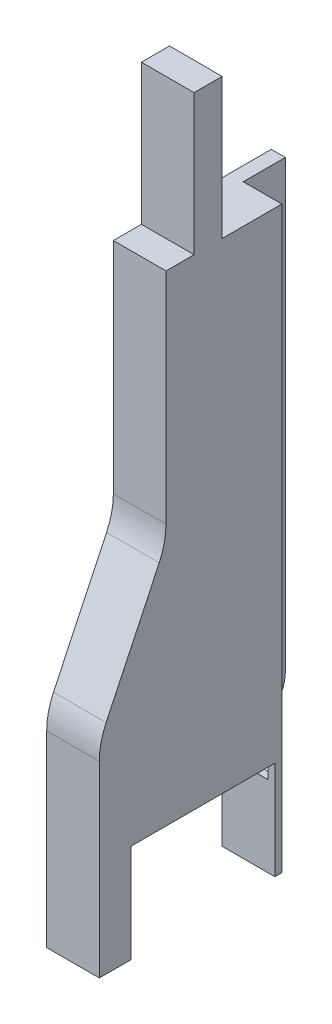
from build123d import *

# Parameters (mm, degrees)
EXTRUDE_1_DEPTH        = 26
EXTRUDE_2_DEPTH        = 19
FILLET_1_R             = 10
SKETCH_5_W             = 161
SKETCH_5_H             = 6
CUT_EXTRUDE_1_DEPTH    = 52
SKETCH_1_5_W           = 11
SKETCH_1_5_H           = 340
EXTRUDE_4_DEPTH        = 7
SKETCH_6_W             = 1.9
SKETCH_6_H             = 2
SKETCH_6_W_2           = 6.6
EXTRUDE_5_DEPTH        = 28
SKETCH_6_3_W           = 6.6
SKETCH_6_3_H           = 2
CUT_EXTRUDE_2_DEPTH    = 5
FILLET_2_R             = 20
SKETCH_6_4_W           = 15
SKETCH_6_4_H           = 10
SKETCH_6_4_H_2         = 9
EXTRUDE_6_DEPTH        = 30
SKETCH_6_5_W           = 15
SKETCH_6_5_H           = 9
EXTRUDE_7_DEPTH        = 28
EXTRUDE_8_DEPTH        = 15
FILLET_3_R             = 20
FILLET_3_OF_MIRROR_2_R = 20
FILLET_4_R             = 20
SKETCH_11_W            = 20
SKETCH_11_H            = 20
CUT_EXTRUDE_3_DEPTH    = 617
SKETCH_10_W            = 20
SKETCH_10_H            = 10
CUT_EXTRUDE_4_DEPTH    = 617
SKETCH_12_W            = 7.5
SKETCH_12_H            = 20
SKETCH_12_W_2          = 0.5
SKETCH_12_W_3          = 16.5
SKETCH_12_W_4          = 12
CUT_EXTRUDE_6_DEPTH    = 37


with BuildPart() as part:
    # 스케치1 → 보스-돌출1 (new body)
    with BuildSketch(Plane.XY):
        Polygon((-168, 0), (168, 0), (183, 0), (183, -340), (168, -340), (168, -20), (-168, -20), (-168, -340), (-183, -340), (-183, 0), align=None)
    extrude(amount=EXTRUDE_1_DEPTH)

    # 스케치1<4> → 보스-돌출2 (add)
    with BuildSketch(Plane.XY):
        Polygon((172, 0), (168, 0), (168, -20), (168, -340), (172, -340), align=None)
        Polygon((-168, -20), (-168, 0), (-172, 0), (-172, -340), (-168, -340), align=None)
    extrude(amount=-EXTRUDE_2_DEPTH)

    # 필렛1
    fillet_1_edges = [part.edges().sort_by_distance(p)[0] for p in [
        (170, 0, -19),
        (170, -340, -19),
        (-170, -340, -19),
        (-170, 0, -19),
    ]]
    fillet(fillet_1_edges, radius=FILLET_1_R)

    # 스케치5 → 컷-돌출1 (cut)
    with BuildSketch(Plane(origin=(0, 0, 0), x_dir=(1, 0, 0), z_dir=(0, 1, 0))):
        with Locations((-87.5, -3)):
            Rectangle(SKETCH_5_W, SKETCH_5_H)
        with Locations((87.5, -3)):
            Rectangle(SKETCH_5_W, SKETCH_5_H)
    extrude(amount=-CUT_EXTRUDE_1_DEPTH, mode=Mode.SUBTRACT)

    # 스케치1<5> → 보스-돌출4 (add)
    with BuildSketch(Plane.XY):
        with Locations((177.5, -170)):
            Rectangle(SKETCH_1_5_W, SKETCH_1_5_H)
        with Locations((-177.5, -170)):
            Rectangle(SKETCH_1_5_W, SKETCH_1_5_H)
    extrude(amount=-EXTRUDE_4_DEPTH)

    # 스케치6 → 보스-돌출5 (add)
    with BuildSketch(Plane.XZ.offset(340)):
        with Locations((-182.05, -6)):
            Rectangle(SKETCH_6_W, SKETCH_6_H)
        with Locations((-177.8, -6)):
            Rectangle(SKETCH_6_W_2, SKETCH_6_H)
        Polygon((-174.5, -7), (-172, -7), (-168, -7), (-168, -5), (-174.5, -5), align=None)
    extrude_5 = extrude(amount=EXTRUDE_5_DEPTH)

    # 스케치6<3> → 컷-돌출2 (cut)
    with BuildSketch(Plane.XZ.offset(340)):
        with Locations((-177.8, -6)):
            Rectangle(SKETCH_6_3_W, SKETCH_6_3_H)
    cut_extrude_2 = extrude(amount=CUT_EXTRUDE_2_DEPTH, mode=Mode.SUBTRACT)

    # 필렛2
    # the kernel refuses this fillet: 20 mm, written as the material it adds along each edge
    with BuildSketch(Plane(origin=(-172, -340, -7), x_dir=(0, -1, 0), z_dir=(1, 0, 0))) as fillet_2_piece_1:
        with BuildLine():
            CenterArc((14, 20), FILLET_2_R, 216.869897646, 53.130102354)
            Line((-2, 8), (-3.6, 6.8))
            ThreePointArc((-3.6, 6.8), (-2, 2), (-2, 0))
            Line((-2, 0), (0, -2))
            Line((0, -2), (14, -2))
            Line((14, -2), (14, 0))
        make_face()
    extrude(amount=4)

    # 스케치6<4> → 보스-돌출6 (add)
    with BuildSketch(Plane.XZ.offset(340)):
        with Locations((-175.5, 31)):
            Rectangle(SKETCH_6_4_W, SKETCH_6_4_H)
        with Locations((-175.5, 40.5)):
            Rectangle(SKETCH_6_4_W, SKETCH_6_4_H_2)
    extrude_6 = extrude(amount=-EXTRUDE_6_DEPTH)

    # 스케치6<5> → 보스-돌출7 (add)
    with BuildSketch(Plane.XZ.offset(340)):
        with Locations((-175.5, 40.5)):
            Rectangle(SKETCH_6_5_W, SKETCH_6_5_H)
    extrude_7 = extrude(amount=EXTRUDE_7_DEPTH)

    # 스케치9 → 보스-돌출8 (add)
    with BuildSketch(Plane.ZY.offset(183)):
        Polygon((26, -310), (45, -310), (26, -270), align=None)
    extrude_8 = extrude(amount=-EXTRUDE_8_DEPTH)

    # 필렛3
    fillet_3_edges = [part.edges().sort_by_distance(p)[0] for p in [
        (-175.5, -310, 45),
        (-175.5, -270, 26),
    ]]
    fillet(fillet_3_edges, radius=FILLET_3_R)

    # 대칭 복사2: 보스-돌출5, 컷-돌출2, 보스-돌출6, 보스-돌출7, 보스-돌출8 across plane
    add(extrude_5.mirror(Plane(origin=(0, 0, 0), x_dir=(0, 0, 1), z_dir=(1, 0, 0))))
    add(cut_extrude_2.mirror(Plane(origin=(0, 0, 0), x_dir=(0, 0, 1), z_dir=(1, 0, 0))), mode=Mode.SUBTRACT)
    add(extrude_6.mirror(Plane(origin=(0, 0, 0), x_dir=(0, 0, 1), z_dir=(1, 0, 0))))
    add(extrude_7.mirror(Plane(origin=(0, 0, 0), x_dir=(0, 0, 1), z_dir=(1, 0, 0))))
    add(extrude_8.mirror(Plane(origin=(0, 0, 0), x_dir=(0, 0, 1), z_dir=(1, 0, 0))))

    # 필렛3 of 대칭 복사2
    fillet_3_of_mirror_2_edges = [part.edges().sort_by_distance(p)[0] for p in [
        (175.5, -310, 45),
        (175.5, -270, 26),
    ]]
    fillet(fillet_3_of_mirror_2_edges, radius=FILLET_3_OF_MIRROR_2_R)

    # 필렛4
    # the kernel refuses this fillet: 20 mm, written as the material it adds along each edge
    with BuildSketch(Plane(origin=(172, -340, -7), x_dir=(0, 0.24253562503633938, -0.9701425001453302), z_dir=(-1, 0, 0))) as fillet_4_piece_1:
        with BuildLine():
            CenterArc((16.007351252, 18.432707503), FILLET_4_R, 194.036243468, 53.130102354)
            Line((-3.395498751, 13.581995002), (-5.335783751, 13.096923752))
            Line((-5.335783751, 13.096923752), (-1.940285, -0.48507125))
            Line((-1.940285, -0.48507125), (0.48507125, -1.940285))
            ThreePointArc((0.48507125, -1.940285), (2.42535625, -1.45521375), (7.470097251, -1.84327075))
            Line((7.470097251, -1.84327075), (8.246211251, 0))
        make_face()
    extrude(amount=4)

    # 스케치11 → 컷-돌출3 (cut)
    with BuildSketch(Plane.ZY.offset(-168)):
        with BuildLine():
            ThreePointArc((45, -314.508610159), (44.510394688, -310.110371974), (43.065550087, -305.927473868))
            Line((43.065550087, -305.927473868), (27.934449913, -274.072526132))
            ThreePointArc((27.934449913, -274.072526132), (26.489605312, -269.889628026), (26, -265.491389841))
            Line((26, -265.491389841), (26, -20))
            Line((26, -20), (6, -20))
            Line((6, -20), (6, 0))
            Line((6, 0), (-7, 0))
            Line((-7, 0), (-7, -354))
            Line((-7, -354), (-7, -368))
            Line((-7, -368), (-5, -368))
            Line((-5, -368), (-5, -340))
            Line((-5, -340), (36, -340))
            Line((36, -340), (36, -368))
            Line((36, -368), (45, -368))
            Line((45, -368), (45, -314.508610159))
        make_face()
        with Locations((16, -10)):
            Rectangle(SKETCH_11_W, SKETCH_11_H)
        with BuildLine():
            Line((-7, -354), (-7, 0))
            Line((-7, 0), (-9, 0))
            ThreePointArc((-9, 0), (-16.071067812, -2.928932188), (-19, -10))
            Line((-19, -10), (-19, -330))
            ThreePointArc((-19, -330), (-17.94427191, -334.472135955), (-15, -338))
            ThreePointArc((-15, -338), (-9.11145618, -345.05572809), (-7, -354))
        make_face()
    extrude(amount=CUT_EXTRUDE_3_DEPTH, mode=Mode.SUBTRACT)

    # 스케치10 → 컷-돌출4 (cut)
    with BuildSketch(Plane(origin=(183, 0, 0), x_dir=(0, 0, -1), z_dir=(1, 0, 0))):
        with Locations((-16, -15)):
            Rectangle(SKETCH_10_W, SKETCH_10_H)
    extrude(amount=-CUT_EXTRUDE_4_DEPTH, mode=Mode.SUBTRACT)

    # 스케치12 → 컷-돌출6 (cut)
    with BuildSketch(Plane.ZY.offset(-168)):
        Polygon((18.5, -162.5), (18.5, -183), (26, -183), (26, -20), (6, -20), (6, -10), (26, -10), (26, 0), (-7, 0), (-7, -183), (9.5, -183), (9.5, -162.5), align=None)
        with Locations((22.25, -193)):
            Rectangle(SKETCH_12_W, SKETCH_12_H)
        with Locations((18.25, -193)):
            Rectangle(SKETCH_12_W_2, SKETCH_12_H)
        with Locations((9.75, -193)):
            Rectangle(SKETCH_12_W_2, SKETCH_12_H)
        Polygon((18, -163), (18, -183), (18.5, -183), (18.5, -162.5), (9.5, -162.5), (9.5, -183), (10, -183), (10, -163), align=None)
        with Locations((1.25, -193)):
            Rectangle(SKETCH_12_W_3, SKETCH_12_H)
        with BuildLine():
            Line((-19, -183), (-7, -183))
            Line((-7, -183), (-7, 0))
            Line((-7, 0), (-9, 0))
            ThreePointArc((-9, 0), (-16.071067812, -2.928932188), (-19, -10))
            Line((-19, -10), (-19, -183))
        make_face()
        with Locations((-13, -193)):
            Rectangle(SKETCH_12_W_4, SKETCH_12_H)
    extrude(amount=-CUT_EXTRUDE_6_DEPTH, mode=Mode.SUBTRACT)


solid = part.part
